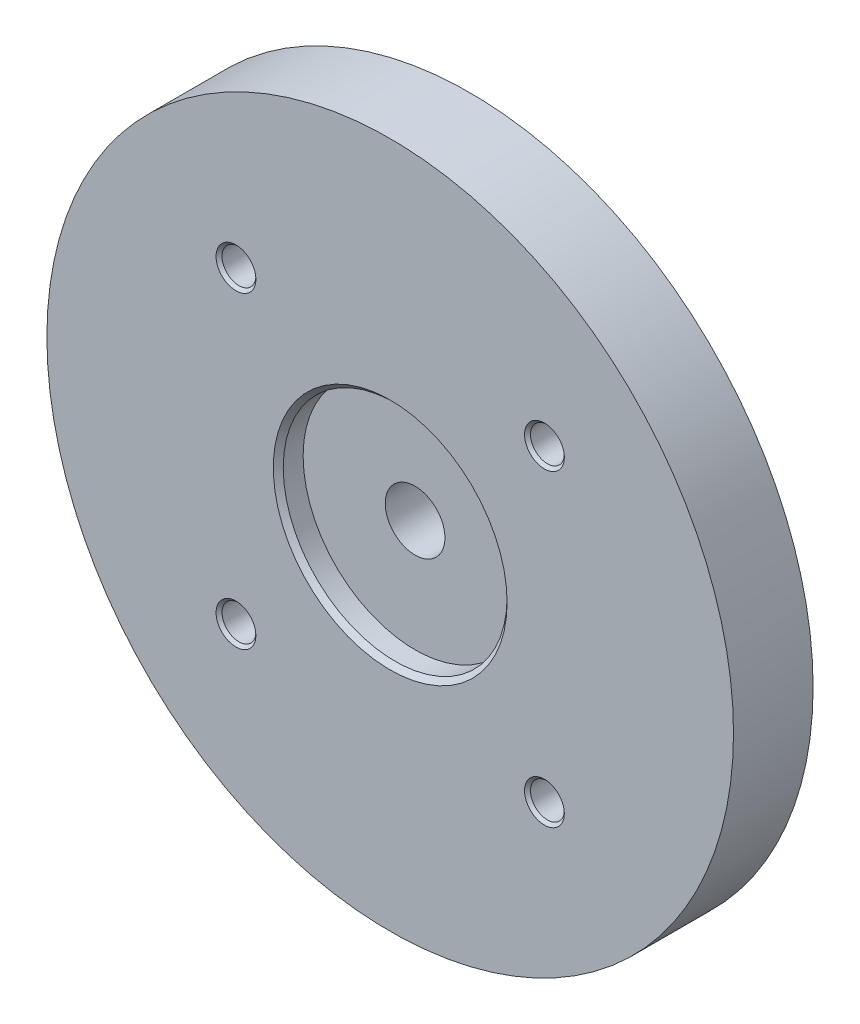
from build123d import *

# Parameters (mm, degrees)
SKETCH2_R               = 34.5
BOSS_EXTRUDE1_DEPTH     = 8
SKETCH6_R               = 10
BOSS_EXTRUDE2_DEPTH     = 2
CUT_EXTRUDE1_DEPTH      = 50.80461826
CUT_EXTRUDE1_DEPTH_BACK = 50.80461826
SKETCH3_R               = 1.7
SKETCH3_R_2             = 3
CUT_EXTRUDE2_DEPTH      = 50.441885077
CUT_EXTRUDE2_DEPTH_BACK = 3
SKETCH4_R               = 2.8
SKETCH5_R               = 2.1
CUT_EXTRUDE3_DEPTH      = 6
FILLET1_R               = 1
SKETCH7_R               = 11.25
CUT_EXTRUDE4_DEPTH      = 2.5
CHAMFER1_SIZE           = 0.5
CHAMFER2_SIZE           = 0.3


with BuildPart() as part:
    # Sketch2 → Boss-Extrude1 (new body)
    with BuildSketch(Plane.XY):
        Circle(SKETCH2_R)
    extrude(amount=BOSS_EXTRUDE1_DEPTH)

    # Sketch6 → Boss-Extrude2 (add)
    with BuildSketch(Plane(origin=(0, 0, 0), x_dir=(-1, 0, 0), z_dir=(0, 0, -1))):
        Circle(SKETCH6_R)
    extrude(amount=BOSS_EXTRUDE2_DEPTH)

    # Sketch3 → Cut-Extrude1 (cut, two sides: drawn at the far end of the back side and taken through both)
    with BuildSketch(Plane.XY.offset(8).offset(-CUT_EXTRUDE1_DEPTH_BACK)):
        with Locations((-15.5, 15.5)):
            Circle(SKETCH3_R)
        with Locations((15.5, 15.5)):
            Circle(SKETCH3_R)
        with Locations((15.5, -15.5)):
            Circle(SKETCH3_R)
        with Locations((-15.5, -15.5)):
            Circle(SKETCH3_R)
        Circle(SKETCH3_R_2)
    extrude(amount=CUT_EXTRUDE1_DEPTH + CUT_EXTRUDE1_DEPTH_BACK, mode=Mode.SUBTRACT)

    # Sketch4 → Cut-Extrude2 (cut, two sides: drawn at the far end of the back side and taken through both)
    with BuildSketch(Plane(origin=(0, 0, 0), x_dir=(-1, 0, 0), z_dir=(0, 0, -1)).offset(-CUT_EXTRUDE2_DEPTH_BACK)):
        with Locations((-15.5, 15.5)):
            Circle(SKETCH4_R)
        with Locations((15.5, 15.5)):
            Circle(SKETCH4_R)
        with Locations((15.5, -15.5)):
            Circle(SKETCH4_R)
        with Locations((-15.5, -15.5)):
            Circle(SKETCH4_R)
    extrude(amount=CUT_EXTRUDE2_DEPTH + CUT_EXTRUDE2_DEPTH_BACK, mode=Mode.SUBTRACT)

    # Sketch5 → Cut-Extrude3 (cut)
    with BuildSketch(Plane(origin=(0, 0, 0), x_dir=(-1, 0, 0), z_dir=(0, 0, -1))):
        with Locations((0, 30)):
            Circle(SKETCH5_R)
        with Locations((30, 0)):
            Circle(SKETCH5_R)
        with Locations((0, -30)):
            Circle(SKETCH5_R)
        with Locations((-30, 0)):
            Circle(SKETCH5_R)
    extrude(amount=-CUT_EXTRUDE3_DEPTH, mode=Mode.SUBTRACT)

    # Fillet1
    fillet1_edges = [part.edges().sort_by_distance(p)[0] for p in [
        (10, 0, 0),
    ]]
    fillet(fillet1_edges, radius=FILLET1_R)

    # Sketch7 → Cut-Extrude4 (cut)
    with BuildSketch(Plane.XY.offset(8)):
        Circle(SKETCH7_R)
    extrude(amount=-CUT_EXTRUDE4_DEPTH, mode=Mode.SUBTRACT)

    # Chamfer1
    chamfer1_edges = [part.edges().sort_by_distance(p)[0] for p in [
        (-11.25, 0, 8),
    ]]
    chamfer(chamfer1_edges, length=CHAMFER1_SIZE)

    # Chamfer2
    chamfer2_edges = [part.edges().sort_by_distance(p)[0] for p in [
        (-17.2, -15.5, 8),
        (13.8, -15.5, 8),
        (13.8, 15.5, 8),
        (-17.2, 15.5, 8),
    ]]
    chamfer(chamfer2_edges, length=CHAMFER2_SIZE)


solid = part.part
